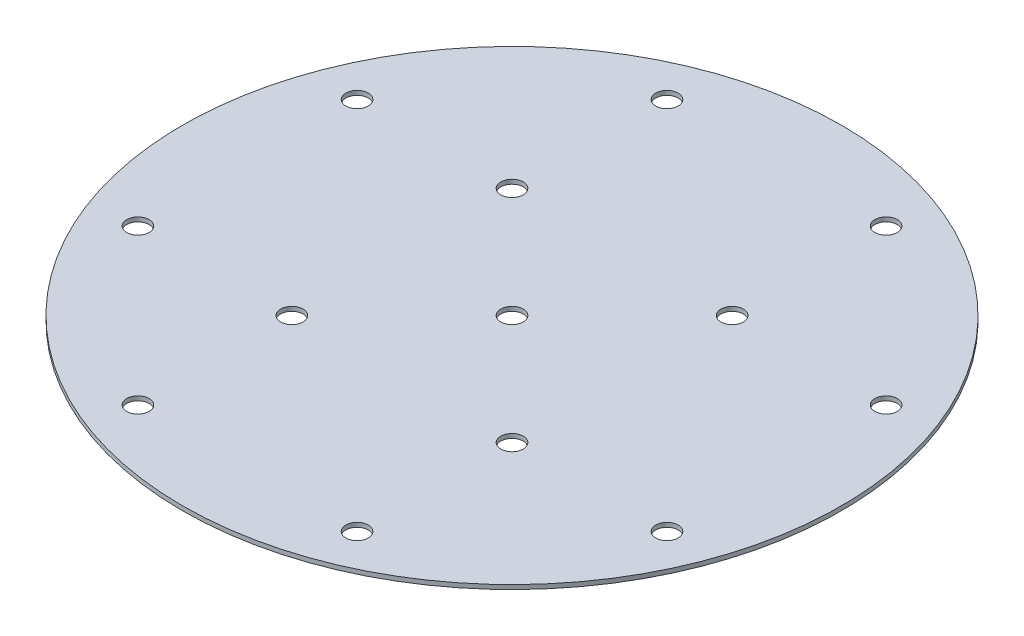
from build123d import *

# Parameters (mm, degrees)
SKETCH2_W                  = 76.2
SKETCH2_H                  = 1
F_6_0_204_DIAMETER_HOLE1_D = 5.1816
CIRPATTERN3_COUNT          = 4
F_6_0_204_DIAMETER_HOLE2_D = 5.1816


with BuildPart() as part:
    # Sketch2 → Revolve1 (revolve)
    with BuildSketch(Plane(origin=(0, 0, 0), x_dir=(0, 0, -1), z_dir=(1, 0, 0))):
        with Locations((-38.1, 0.5)):
            Rectangle(SKETCH2_W, SKETCH2_H)
    revolve(axis=Axis((0, -0.05, 0), (0, 1, 0)))

    # #6 (0.204) Diameter Hole1 (through all)
    with Locations(Plane(origin=(0, 1, 0), x_dir=(1, 0, 0), z_dir=(0, 1, 0))):
        with Locations((-25.333643223, 61.160825052), (264.743675233, 73.787758551), (-61.160825052, 25.333643223), (-25.455844123, 25.455844123)):
            f_6_0_204_diameter_hole1 = Hole(F_6_0_204_DIAMETER_HOLE1_D / 2)

    # CirPattern3: #6 (0.204) Diameter Hole1 ×4 about axis
    cirpattern3_axis = Axis((0, -0.05, 0), (0, 1, 0))
    for i in range(1, CIRPATTERN3_COUNT):
        add(f_6_0_204_diameter_hole1.rotate(cirpattern3_axis, i * 360 / CIRPATTERN3_COUNT), mode=Mode.SUBTRACT)

    # #6 (0.204) Diameter Hole2 (through all)
    with Locations(Plane(origin=(0, 1, 0), x_dir=(1, 0, 0), z_dir=(0, 1, 0))):
        with Locations((0, 0)):
            Hole(F_6_0_204_DIAMETER_HOLE2_D / 2)


solid = part.part
